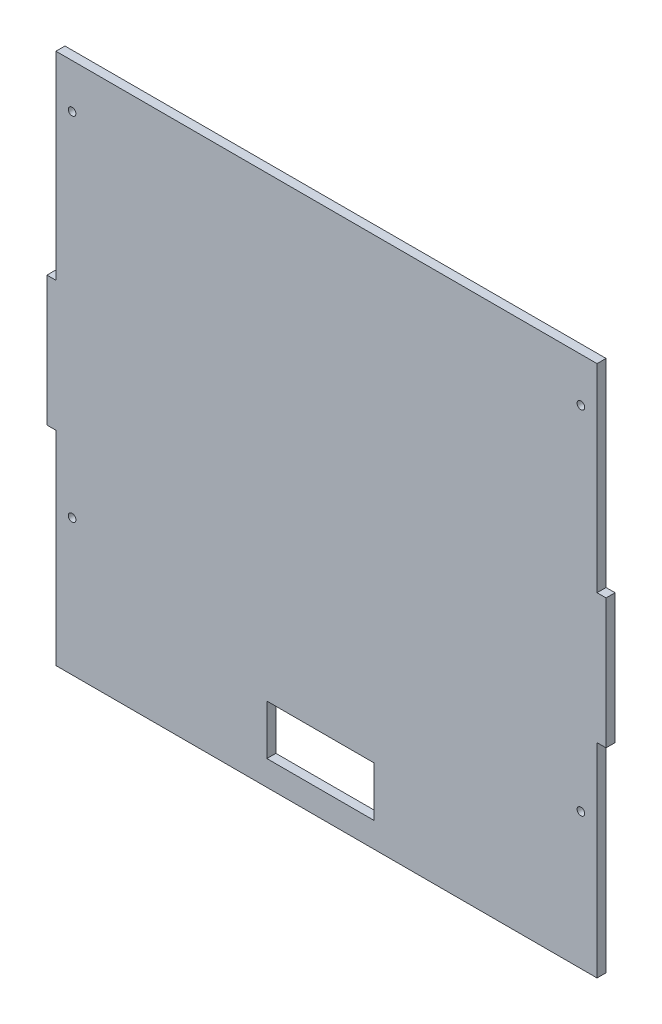
from build123d import *

# Parameters (mm, degrees)
ESQUISSE1_W                        = 300
ESQUISSE1_H                        = 295
BOSS_EXTRU_1_DEPTH                 = 5
TENON_START                        = -182
TENON_ET_MORTAISE_TENON1_OUTLINE_W = 5
TENON_ET_MORTAISE_TENON1_OUTLINE_H = 5
TENON_ET_MORTAISE_TENON1_DEPTH     = 72
TENON_ET_MORTAISE_TENON2_OUTLINE_W = 5
TENON_ET_MORTAISE_TENON2_OUTLINE_H = 5
TENON_ET_MORTAISE_TENON2_DEPTH     = 72
ESQUISSE2_W                        = 59.408594242
ESQUISSE2_H                        = 27.612445211
ENL_V_MAT_EXTRU_2_DEPTH            = 10
ESQUISSE3_R                        = 2.100000001
ENL_V_MAT_EXTRU_3_DEPTH            = 425.352447854
ESQUISSE4_R                        = 2.1
ENL_V_MAT_EXTRU_4_DEPTH            = 425.352447854
ESQUISSE5_R                        = 2.1
ENL_V_MAT_EXTRU_5_DEPTH            = 425.352447854


# Read off the part's stored shape, not the designer's step: Tenon et mortaise-Tenon1, Tenon et mortaise-Tenon2
with BuildPart() as part:
    # Esquisse1 → Boss.-Extru.1 (new body)
    with BuildSketch(Plane.XY):
        with Locations((-150, -147.5)):
            Rectangle(ESQUISSE1_W, ESQUISSE1_H)
    extrude(amount=BOSS_EXTRU_1_DEPTH)

    # Tenon et mortaise-Tenon1 outline → Tenon et mortaise-Tenon1 (add)
    with BuildSketch(Plane(origin=(0, 0, 0), x_dir=(1, 0, 0), z_dir=(0, 1, 0)).offset(TENON_START)):
        with Locations((2.5, -2.5)):
            Rectangle(TENON_ET_MORTAISE_TENON1_OUTLINE_W, TENON_ET_MORTAISE_TENON1_OUTLINE_H)
    extrude(amount=TENON_ET_MORTAISE_TENON1_DEPTH)

    # Tenon et mortaise-Tenon2 outline → Tenon et mortaise-Tenon2 (add)
    with BuildSketch(Plane(origin=(0, 0, 0), x_dir=(1, 0, 0), z_dir=(0, 1, 0)).offset(TENON_START)):
        with Locations((-302.5, -2.5)):
            Rectangle(TENON_ET_MORTAISE_TENON2_OUTLINE_W, TENON_ET_MORTAISE_TENON2_OUTLINE_H)
    extrude(amount=TENON_ET_MORTAISE_TENON2_DEPTH)

    # Esquisse2 → Enlèv. mat.-Extru.2 (cut)
    with BuildSketch(Plane(origin=(0, 0, 0), x_dir=(-1, 0, 0), z_dir=(0, 0, -1))):
        with Locations((153.346963056, -267.352892149)):
            Rectangle(ESQUISSE2_W, ESQUISSE2_H)
    extrude(amount=-ENL_V_MAT_EXTRU_2_DEPTH, mode=Mode.SUBTRACT)

    # Esquisse3 → Enlèv. mat.-Extru.3 (cut, through all)
    with BuildSketch(Plane(origin=(0, 0, 0), x_dir=(-1, 0, 0), z_dir=(0, 0, -1))):
        with Locations((291.051040249, -219.502837044)):
            Circle(ESQUISSE3_R)
        with Locations(Location((8.948959751, -219.502837044, 0), (0, 0, 180))):
            Circle(ESQUISSE3_R)
    extrude(amount=-ENL_V_MAT_EXTRU_3_DEPTH, mode=Mode.SUBTRACT)

    # Esquisse4 → Enlèv. mat.-Extru.4 (cut, through all)
    with BuildSketch(Plane(origin=(0, 0, 0), x_dir=(-1, 0, 0), z_dir=(0, 0, -1))):
        with Locations((291.051040249, -24.502837044)):
            Circle(ESQUISSE4_R)
    extrude(amount=-ENL_V_MAT_EXTRU_4_DEPTH, mode=Mode.SUBTRACT)

    # Esquisse5 → Enlèv. mat.-Extru.5 (cut, through all)
    with BuildSketch(Plane(origin=(0, 0, 0), x_dir=(-1, 0, 0), z_dir=(0, 0, -1))):
        with Locations((291.051040249, -24.502837044)):
            Circle(ESQUISSE5_R)
        with Locations(Location((8.948959751, -24.502837044, 0), (0, 0, 180))):
            Circle(ESQUISSE5_R)
    extrude(amount=-ENL_V_MAT_EXTRU_5_DEPTH, mode=Mode.SUBTRACT)


solid = part.part
